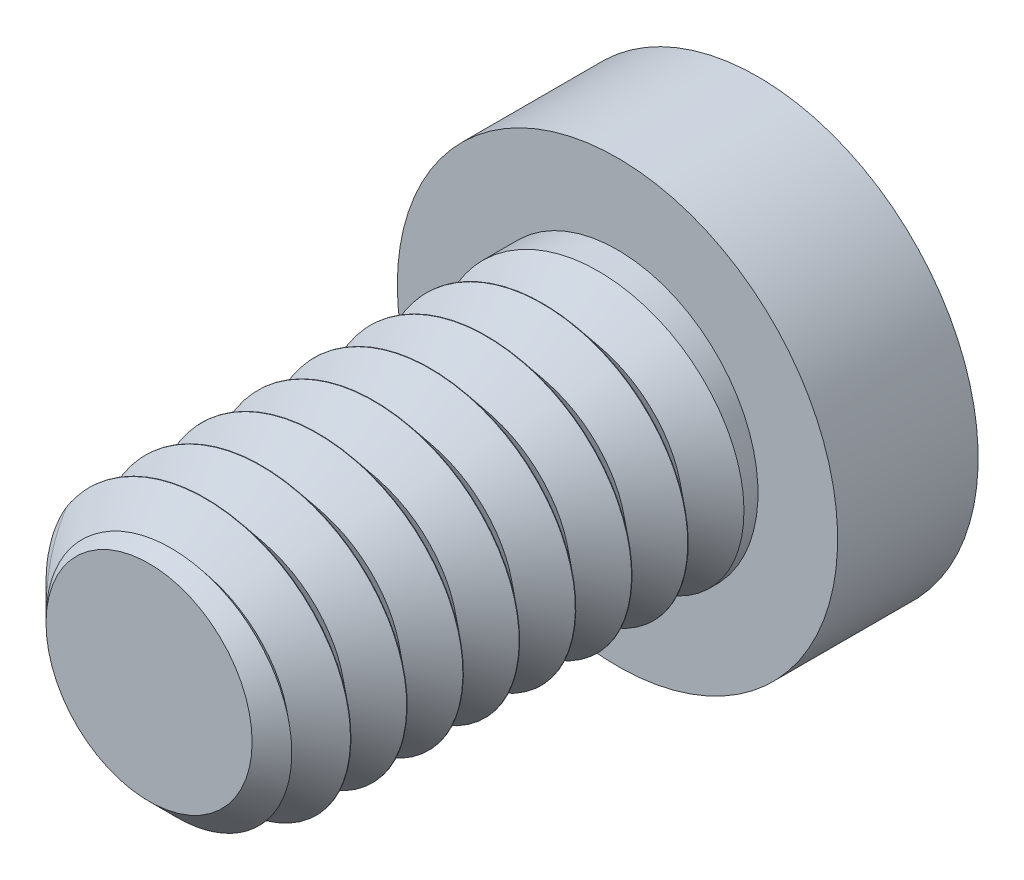
from build123d import *

# Parameters (mm, degrees)
SKETCH1_R           = 3
BOSS_EXTRUDE1_DEPTH = 10
CHAMFER3_SIZE       = 0.8
CUT_SWEEP3_PITCH    = 1.2
SKETCH5_R           = 4.7
BOSS_EXTRUDE2_DEPTH = 3
SKETCH4_W           = 2.08
SKETCH4_H           = 2.08
CUT_EXTRUDE1_DEPTH  = 5
CUT_EXTRUDE1_DRAFT  = -1


with BuildPart() as part:
    # Sketch1 → Boss-Extrude1 (new body)
    with BuildSketch(Plane.XY):
        Circle(SKETCH1_R)
    extrude(amount=BOSS_EXTRUDE1_DEPTH)

    # Chamfer3
    chamfer3_edges = [part.edges().sort_by_distance(p)[0] for p in [
        (-3, 0, 10),
    ]]
    chamfer(chamfer3_edges, length=CHAMFER3_SIZE)

    # Cut-Sweep3: the profile of Sketch3 profile screwed along a right-hand helix of 29.166667 turns, 8 arcs to a turn; built about Z, then put on its axis
    cut_sweep3_z = Axis((0, 0, 0), (0, 0, 1))
    cut_sweep3_corners = [(3.0003, 0, 0.595247917), (3.0003, 0, -0.595247917), (2.28, 0, 0)]
    with BuildLine(mode=Mode.PRIVATE) as cut_sweep3_profile:
        Line(cut_sweep3_corners[0], cut_sweep3_corners[1])
        Line(cut_sweep3_corners[1], cut_sweep3_corners[2])
        Line(cut_sweep3_corners[2], cut_sweep3_corners[0])
    cut_sweep3_cap = Face(cut_sweep3_profile.wire())
    cut_sweep3_turn_angles = [0, 22.5, 45, 67.5, 90, 112.5, 135, 157.5, 180, 202.5, 225, 247.5, 270, 292.5, 315, 337.5, 360]
    cut_sweep3_turn_weights = [1, 0.9238795325112867, 1, 0.9238795325112867, 1, 0.9238795325112867, 1, 0.9238795325112867, 1, 0.9238795325112867, 1, 0.9238795325112867, 1, 0.9238795325112867, 1, 0.9238795325112867, 1]
    cut_sweep3_turn_rails = [Edge.make_bspline([Vector(p[0], p[1], 0).rotate(cut_sweep3_z, cut_sweep3_turn_angles[k]) / cut_sweep3_turn_weights[k] + Vector(0, 0, p[2] + CUT_SWEEP3_PITCH * cut_sweep3_turn_angles[k] / 360) for k in range(17)], [0, 0, 0, 1, 1, 2, 2, 3, 3, 4, 4, 5, 5, 6, 6, 7, 7, 8, 8, 8], 2, cut_sweep3_turn_weights) for p in cut_sweep3_corners]
    cut_sweep3_turn_sides = [Face.make_surface_from_curves(cut_sweep3_turn_rails[p[0]], cut_sweep3_turn_rails[p[1]]) for p in [(0, 1), (1, 2), (2, 0)]]
    cut_sweep3_last_angles = [10440, 10462.5, 10485, 10492.5, 10500]
    cut_sweep3_last_weights = [1, 0.9238795325112867, 1, 0.9914448613738477, 1]
    cut_sweep3_last_rails = [Edge.make_bspline([Vector(p[0], p[1], 0).rotate(cut_sweep3_z, cut_sweep3_last_angles[k]) / cut_sweep3_last_weights[k] + Vector(0, 0, p[2] + CUT_SWEEP3_PITCH * cut_sweep3_last_angles[k] / 360) for k in range(5)], [0, 0, 0, 1, 1, 2, 2, 2], 2, cut_sweep3_last_weights) for p in cut_sweep3_corners]
    cut_sweep3_last_sides = [Face.make_surface_from_curves(cut_sweep3_last_rails[p[0]], cut_sweep3_last_rails[p[1]]) for p in [(0, 1), (1, 2), (2, 0)]]
    cut_sweep3 = Plane(origin=(0, 0, 0.6), x_dir=(0, -1, 0), z_dir=(0, 0, 1)) * Solid(Shell([*[p.moved(Location((0, 0, CUT_SWEEP3_PITCH * i))) for i in range(29) for p in cut_sweep3_turn_sides], *cut_sweep3_last_sides, cut_sweep3_cap, cut_sweep3_cap.rotate(cut_sweep3_z, 10500).moved(Location((0, 0, CUT_SWEEP3_PITCH * 10500 / 360)))]))
    add(cut_sweep3, mode=Mode.SUBTRACT)

    # Sketch5 → Boss-Extrude2 (add)
    with BuildSketch(Plane(origin=(0, 0, 0), x_dir=(-1, 0, 0), z_dir=(0, 0, -1))):
        Circle(SKETCH5_R)
    extrude(amount=BOSS_EXTRUDE2_DEPTH)


with BuildPart() as cut_extrude1_tool:
    # Sketch4 → Cut-Extrude1 (with draft: the straight prism first)
    with BuildSketch(Plane(origin=(0, 0, -3), x_dir=(-1, 0, 0), z_dir=(0, 0, -1))):
        Rectangle(SKETCH4_W, SKETCH4_H)
    extrude(amount=-CUT_EXTRUDE1_DEPTH)
    # Cut-Extrude1: the draft: its side faces are tilted about the plane it starts from
    cut_extrude1_sides = [cut_extrude1_tool.faces().sort_by_distance(p)[0] for p in [
        (-1.04, 0, -0.5),
        (0, 1.04, -0.5),
        (1.04, 0, -0.5),
        (0, -1.04, -0.5),
    ]]
    draft(cut_extrude1_sides, Plane(origin=(0, 0, -3), x_dir=(-1, 0, 0), z_dir=(0, 0, -1)), CUT_EXTRUDE1_DRAFT)


with BuildPart() as part_1:
    add(part.part)

    # Cut-Extrude1: cut by cut_extrude1_tool
    add(cut_extrude1_tool.part, mode=Mode.SUBTRACT)


solid = part_1.part
